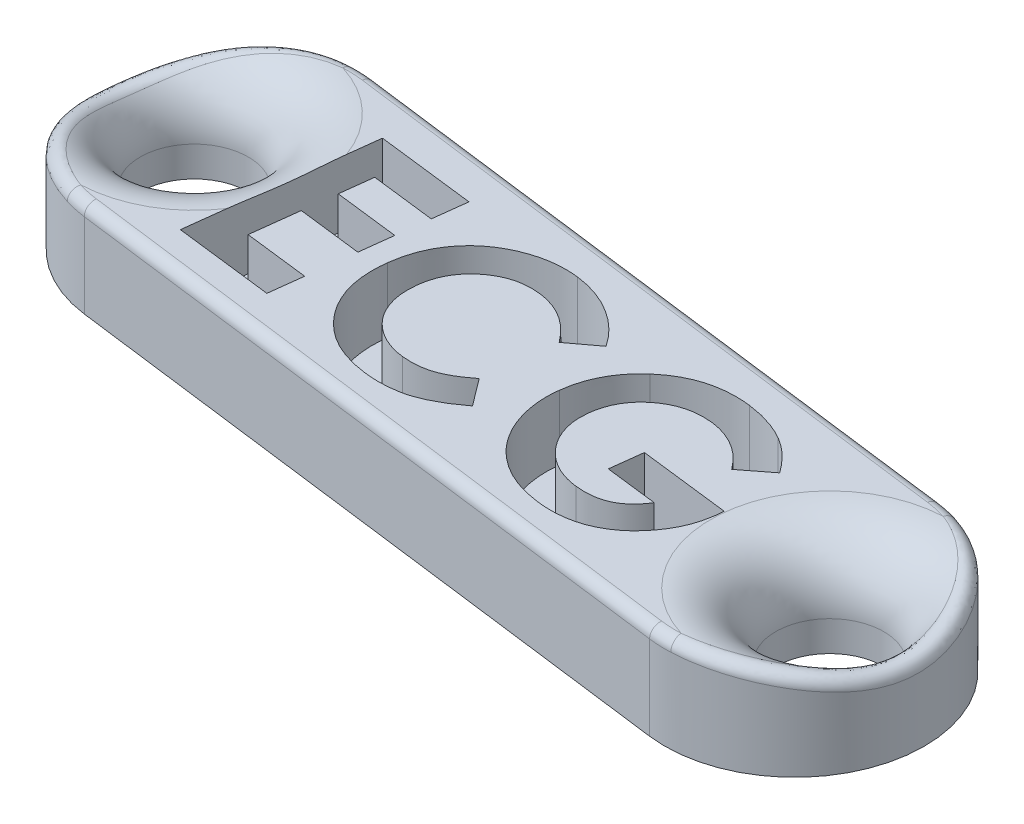
from build123d import *

# Parameters (mm, degrees)
BOSS_EXTRUDE1_DEPTH = 2.2
SKETCH3_R           = 1.25
CUT_EXTRUDE1_DEPTH  = 3
CUT_EXTRUDE2_DEPTH  = 1.5
FILLET1_R           = 1.5
FILLET7_R           = 0.25


with BuildPart() as part:
    # Sketch1 → Boss-Extrude1 (new body)
    with BuildSketch(Plane(origin=(0, 0, 0), x_dir=(1, 0, 0), z_dir=(0, 1, 0))):
        with BuildLine():
            Line((-7.119052023, 3.935857167), (7.880947977, 2.015572456))
            ThreePointArc((7.880947977, 2.015572456), (10.475714811, -1.341090333), (7.119052023, -3.935857167))
            Line((7.119052023, -3.935857167), (-7.880947977, -2.015572456))
            ThreePointArc((-7.880947977, -2.015572456), (-10.475714811, 1.341090333), (-7.119052023, 3.935857167))
        make_face()
    extrude(amount=BOSS_EXTRUDE1_DEPTH)

    # Sketch3 → Cut-Extrude1 (cut)
    with BuildSketch(Plane(origin=(0, 2.2, 0), x_dir=(1, 0, 0), z_dir=(0, 1, 0))):
        with Locations(Location((-8.431191966, 1.079352602, 0), (0, 0, 270))):
            Circle(SKETCH3_R)
        with Locations(Location((8.431191966, -1.079352602, 0), (0, 0, 270))):
            Circle(SKETCH3_R)
    extrude(amount=-CUT_EXTRUDE1_DEPTH, mode=Mode.SUBTRACT)

    # Sketch2 → Cut-Extrude2 (cut)
    with BuildSketch(Plane(origin=(0, 2.2, 0), x_dir=(1, 0, 0), z_dir=(0, 1, 0))):
        Polygon((-5.755753406, 2.758586424), (-3.478810297, 2.482978785), (-3.572940906, 1.705341232), (-5.061222156, 1.885122215), (-5.151960671, 1.131229319), (-3.663679421, 0.951448337), (-3.756113983, 0.189075206), (-5.244395233, 0.368856189), (-5.377534923, -0.728486225), (-3.889253673, -0.908267208), (-3.983384282, -1.688448832), (-6.260327391, -1.412841193), align=None)
        with BuildLine():
            Line((1.001287101, 1.174388755), (0.38138192, 0.710519898))
            add(Edge.make_bspline(
                [(0.38138192, 0.710519898), (0.339907613, 0.763880498), (0.258781245, 0.868257209), (0.124147649, 1.008204653), (-0.016431096, 1.1309551), (-0.164250314, 1.234701384), (-0.319093637, 1.320558606), (-0.480652107, 1.387556123), (-0.649012659, 1.437088172), (-0.764593546, 1.454695824), (-0.822811456, 1.46356477)],
                knots=[0, 0, 0, 0, 1.108790908, 2.168865199, 3.182047536, 4.168153944, 5.127710862, 6.08254375, 7.034180319, 8, 8, 8, 8], degree=3))
            add(Edge.make_bspline(
                [(-0.822811456, 1.46356477), (-0.871945413, 1.468588946), (-0.968373777, 1.478449195), (-1.112120386, 1.474795944), (-1.251346797, 1.460261609), (-1.386341531, 1.431110512), (-1.516791346, 1.388515197), (-1.642926234, 1.332157847), (-1.764720825, 1.262147666), (-1.880649901, 1.179543408), (-1.988777712, 1.086962675), (-2.085926714, 0.985578857), (-2.171480701, 0.876835298), (-2.243309433, 0.759621132), (-2.305487808, 0.636139794), (-2.353360208, 0.504252552), (-2.38938141, 0.365004543), (-2.403814451, 0.269145393), (-2.41115948, 0.220362313)],
                knots=[0, 0, 0, 0, 1.052642957, 2.065875484, 3.060764577, 4.035343905, 5.005978876, 5.983166527, 6.977196326, 7.997848495, 9.01557503, 10.009312133, 10.988804212, 11.961030067, 12.93726835, 13.933143802, 14.948169155, 16, 16, 16, 16], degree=3))
            add(Edge.make_bspline(
                [(-2.41115948, 0.220362313), (-2.414682864, 0.186189579), (-2.421659114, 0.118528067), (-2.424792083, 0.017408498), (-2.422440409, -0.081421976), (-2.41390286, -0.178009521), (-2.399472091, -0.272333387), (-2.379210871, -0.364719086), (-2.352870931, -0.454822226), (-2.3206034, -0.542397648), (-2.282526175, -0.626771823), (-2.239477231, -0.707912071), (-2.189615486, -0.783980139), (-2.136361713, -0.857695581), (-2.07664337, -0.927005757), (-2.01235478, -0.993303363), (-1.942602983, -1.055345941), (-1.86783715, -1.112771481), (-1.789471122, -1.16635695), (-1.706873808, -1.213458243), (-1.622223262, -1.25633634), (-1.534014027, -1.292414503), (-1.443641071, -1.325488341), (-1.349171211, -1.350106329), (-1.25217272, -1.371030188), (-1.186120182, -1.380270091), (-1.152692599, -1.384946181)],
                knots=[0, 0, 0, 0, 1.081513024, 2.14137991, 3.183188021, 4.192979156, 5.192557174, 6.186052631, 7.169125398, 8.146377767, 9.122494361, 10.082280144, 11.035355505, 11.984306692, 12.944009917, 13.91340653, 14.890658899, 15.880598942, 16.880493984, 17.877492441, 18.872701132, 19.866236465, 20.876968766, 21.900476918, 22.937482463, 24, 24, 24, 24], degree=3))
            add(Edge.make_bspline(
                [(-1.152692599, -1.384946181), (-1.095931408, -1.390004726), (-0.984500042, -1.399935465), (-0.818638147, -1.395791692), (-0.658744047, -1.373249868), (-0.528533482, -1.341771259), (-0.426162575, -1.305578155), (-0.34684601, -1.271942103), (-0.264544067, -1.23310381), (-0.179820352, -1.18737488), (-0.093335181, -1.133977735), (-0.003330233, -1.076093294), (0.088208177, -1.010077162), (0.149681701, -0.963599919), (0.181248373, -0.939733841)],
                knots=[0, 0, 0, 0, 1.415064442, 2.777999525, 4.110910369, 5.420790316, 6.098256209, 6.806511331, 7.560473776, 8.358639852, 9.196952851, 10.08523006, 11.016765106, 12, 12, 12, 12], degree=3))
            Line((0.181248373, -0.939733841), (0.651901418, -1.566423211))
            add(Edge.make_bspline(
                [(0.651901418, -1.566423211), (0.609363773, -1.597996987), (0.526214817, -1.659714707), (0.401750427, -1.746961915), (0.278712285, -1.823653103), (0.158663836, -1.893008251), (0.041208592, -1.953774087), (-0.073300151, -2.007119508), (-0.185790595, -2.050060322), (-0.295954469, -2.086601641), (-0.406974323, -2.114285954), (-0.519433231, -2.137695053), (-0.635066381, -2.153475196), (-0.753390342, -2.163473703), (-0.874766364, -2.168686498), (-0.99931683, -2.167994616), (-1.126895442, -2.159972947), (-1.212648227, -2.151015493), (-1.256151467, -2.146471288)],
                knots=[0, 0, 0, 0, 1.237411397, 2.418786136, 3.549109657, 4.622781696, 5.656380138, 6.637260003, 7.57161251, 8.467374033, 9.346556179, 10.242633998, 11.149328105, 12.070523369, 13.015546583, 13.986172483, 14.978365299, 16, 16, 16, 16], degree=3))
            add(Edge.make_bspline(
                [(-1.256151467, -2.146471288), (-1.335306552, -2.135274875), (-1.490478126, -2.113326001), (-1.714092962, -2.05512783), (-1.92522605, -1.981907537), (-2.122663198, -1.889063155), (-2.306855586, -1.778349608), (-2.477805395, -1.649706023), (-2.633923901, -1.501721022), (-2.777070434, -1.339116949), (-2.901957917, -1.162324841), (-3.007807279, -0.975757518), (-3.093334976, -0.780667662), (-3.156851176, -0.576655029), (-3.200619349, -0.364198715), (-3.221767367, -0.143140284), (-3.224216426, 0.086274813), (-3.209182871, 0.240793343), (-3.201517386, 0.319581063)],
                knots=[0, 0, 0, 0, 1.087864914, 2.13259467, 3.140654736, 4.127373104, 5.097821131, 6.062487821, 7.034682597, 8.022189064, 9.008005977, 9.976780585, 10.938678378, 11.902922557, 12.881323775, 13.887161772, 14.922681284, 16, 16, 16, 16], degree=3))
            add(Edge.make_bspline(
                [(-3.201517386, 0.319581063), (-3.194548117, 0.37085516), (-3.18080427, 0.471970975), (-3.148943416, 0.620060752), (-3.109127711, 0.762452377), (-3.061668102, 0.899707973), (-3.005507143, 1.031428035), (-2.941258992, 1.158023293), (-2.867703241, 1.278554219), (-2.787457572, 1.394449999), (-2.69814106, 1.503063168), (-2.603443801, 1.606663837), (-2.499846289, 1.701363597), (-2.390913556, 1.790917032), (-2.273763627, 1.872063089), (-2.150955678, 1.948281837), (-2.02005273, 2.015457916), (-1.883710228, 2.076586698), (-1.743401081, 2.129772243), (-1.600255203, 2.17309229), (-1.456078286, 2.207051334), (-1.310501161, 2.231706494), (-1.163507721, 2.24730179), (-1.015049467, 2.251922447), (-0.865175638, 2.248189566), (-0.765381674, 2.237903491), (-0.715112471, 2.232722088)],
                knots=[0, 0, 0, 0, 1.063671236, 2.09762803, 3.111591302, 4.102366731, 5.081549333, 6.053737683, 7.01865355, 7.982886452, 8.949656145, 9.907984879, 10.866313613, 11.833083306, 12.805410645, 13.794291844, 14.802960407, 15.828057363, 16.865488062, 17.885960746, 18.901039554, 19.909138579, 20.920098794, 21.937853218, 22.961235026, 24, 24, 24, 24], degree=3))
            add(Edge.make_bspline(
                [(-0.715112471, 2.232722088), (-0.672351433, 2.226984036), (-0.586998642, 2.215530648), (-0.460749194, 2.189811269), (-0.336492094, 2.157489084), (-0.214424519, 2.11856053), (-0.094418725, 2.072584365), (0.023333336, 2.01964535), (0.13996146, 1.961594682), (0.253151031, 1.895268772), (0.362886962, 1.823172867), (0.469490573, 1.747197704), (0.570293439, 1.664705938), (0.666260193, 1.576966056), (0.758337639, 1.484709938), (0.844214937, 1.386110791), (0.926665918, 1.283478432), (0.976306061, 1.210908863), (1.001287101, 1.174388755)],
                knots=[0, 0, 0, 0, 0.99536994, 1.986799332, 2.970884144, 3.956955873, 4.941840252, 5.934642044, 6.935234821, 7.946613122, 8.959777847, 9.964508172, 10.965951071, 11.963306778, 12.964218435, 13.971803263, 14.979324746, 16, 16, 16, 16], degree=3))
        make_face()
        with BuildLine():
            Line((5.547100934, 0.647207502), (4.921259588, 0.161290034))
            add(Edge.make_bspline(
                [(4.921259588, 0.161290034), (4.882333786, 0.211546244), (4.806292695, 0.309721151), (4.678396464, 0.441229444), (4.543497469, 0.556342854), (4.400299043, 0.654549737), (4.249539014, 0.735477498), (4.091266251, 0.799583935), (3.925215962, 0.847076538), (3.810601985, 0.864152582), (3.752683199, 0.872781754)],
                knots=[0, 0, 0, 0, 1.082224105, 2.114111883, 3.118543312, 4.098942051, 5.066304023, 6.027606095, 7.003274623, 8, 8, 8, 8], degree=3))
            add(Edge.make_bspline(
                [(3.752683199, 0.872781754), (3.702136576, 0.877697385), (3.602883112, 0.887349728), (3.455452914, 0.885236661), (3.312885601, 0.870151349), (3.174755992, 0.841263461), (3.041396443, 0.798517416), (2.912224267, 0.743506124), (2.788798492, 0.673000656), (2.671120823, 0.590513039), (2.561659424, 0.498140699), (2.463501378, 0.397739738), (2.377899721, 0.290066792), (2.304894075, 0.175093427), (2.243260619, 0.053419528), (2.195078018, -0.075808482), (2.157795058, -0.21170919), (2.144126886, -0.305776873), (2.137198424, -0.353460233)],
                knots=[0, 0, 0, 0, 1.077476719, 2.115735728, 3.123723398, 4.117081565, 5.105879394, 6.09243478, 7.092099243, 8.117637238, 9.139587089, 10.128384918, 11.093722372, 12.054291497, 13.015085546, 13.983663209, 14.977909201, 16, 16, 16, 16], degree=3))
            add(Edge.make_bspline(
                [(2.137198424, -0.353460233), (2.132600744, -0.403159578), (2.123573499, -0.500741005), (2.126014978, -0.646324137), (2.14418021, -0.787457152), (2.175559698, -0.924712557), (2.22086658, -1.058042649), (2.280229948, -1.187259074), (2.355078176, -1.31185666), (2.442464929, -1.43111649), (2.540807973, -1.542311576), (2.648072744, -1.642137956), (2.763429386, -1.729416966), (2.886764962, -1.80378367), (3.017503018, -1.867677371), (3.156764949, -1.917007928), (3.303777703, -1.955104899), (3.405095881, -1.969890948), (3.456722996, -1.977425244)],
                knots=[0, 0, 0, 0, 1.026608968, 2.01567986, 2.989024484, 3.950000734, 4.908420604, 5.881886902, 6.87054715, 7.894433122, 8.920514559, 9.920744447, 10.905013829, 11.891686886, 12.880347134, 13.894219595, 14.92699049, 16, 16, 16, 16], degree=3))
            add(Edge.make_bspline(
                [(3.456722996, -1.977425244), (3.490334146, -1.980845689), (3.556600311, -1.987589279), (3.654561589, -1.992174811), (3.74920476, -1.989563491), (3.840051897, -1.980833178), (3.928107896, -1.967847784), (4.012363752, -1.947065602), (4.093803873, -1.922056946), (4.171265239, -1.889278243), (4.246027315, -1.850947378), (4.318811672, -1.807202174), (4.38722735, -1.754424907), (4.454369049, -1.69729593), (4.518229546, -1.633023289), (4.579422349, -1.562691785), (4.637175647, -1.484883406), (4.673078378, -1.429797635), (4.691445219, -1.401617284)],
                knots=[0, 0, 0, 0, 1.116837852, 2.201905125, 3.239617865, 4.243927897, 5.218043446, 6.179116346, 7.110140328, 8.031735976, 8.955414115, 9.886625691, 10.834246109, 11.808361658, 12.799585801, 13.826426824, 14.888060325, 16, 16, 16, 16], degree=3))
            Line((4.691445219, -1.401617284), (3.483859749, -1.255757242))
            Line((3.483859749, -1.255757242), (3.574598263, -0.510344581))
            Line((3.574598263, -0.510344581), (5.672608413, -0.763903609))
            Line((5.672608413, -0.763903609), (5.65734399, -0.940292498))
            add(Edge.make_bspline(
                [(5.65734399, -0.940292498), (5.650823224, -0.985613884), (5.637873468, -1.075618791), (5.608836701, -1.208602113), (5.570893913, -1.338519008), (5.522626822, -1.464963696), (5.467868215, -1.589493448), (5.402902645, -1.710694176), (5.330123901, -1.829538721), (5.248847001, -1.944339096), (5.161501831, -2.05353676), (5.069229542, -2.156058385), (4.973315566, -2.251151815), (4.871280224, -2.336773182), (4.766488012, -2.416443328), (4.655869932, -2.486264133), (4.541758032, -2.549735609), (4.423254155, -2.604626778), (4.300609411, -2.651500753), (4.174032653, -2.689928596), (4.043229158, -2.718477715), (3.908633164, -2.738610263), (3.770493891, -2.751715952), (3.628260987, -2.754899252), (3.482171468, -2.748745056), (3.383753375, -2.738875621), (3.333759588, -2.73386221)],
                knots=[0, 0, 0, 0, 1.006578571, 1.998990296, 2.990272399, 3.979662424, 4.973027484, 5.979606055, 7.000873861, 8.035596299, 9.070393411, 10.073877441, 11.067223055, 12.037389839, 13.000823087, 13.959512707, 14.910981637, 15.870396377, 16.828521635, 17.795976668, 18.776245708, 19.769591321, 20.787031089, 21.825350433, 22.895335564, 24, 24, 24, 24], degree=3))
            add(Edge.make_bspline(
                [(3.333759588, -2.73386221), (3.280509626, -2.726595801), (3.175172049, -2.712221596), (3.020594754, -2.679566872), (2.871640985, -2.639105528), (2.728047073, -2.590403653), (2.589909119, -2.533892931), (2.457109603, -2.468259459), (2.330004483, -2.394455992), (2.208543793, -2.313152449), (2.093798787, -2.223861896), (1.986364136, -2.127541476), (1.886640177, -2.02412368), (1.793923348, -1.914759162), (1.709218139, -1.798355489), (1.631565559, -1.675433418), (1.561274194, -1.546113103), (1.499674999, -1.410489475), (1.446498834, -1.271128379), (1.402000894, -1.12937112), (1.36825351, -0.985599051), (1.343601166, -0.840582059), (1.328348445, -0.694418543), (1.322236726, -0.546852051), (1.326337493, -0.397796908), (1.336598124, -0.298290603), (1.341752377, -0.248305319)],
                knots=[0, 0, 0, 0, 1.086404573, 2.14909496, 3.191799546, 4.205801276, 5.213095556, 6.207447127, 7.198573695, 8.183019474, 9.160555024, 10.135999586, 11.098039105, 12.063333118, 13.032797836, 14.006432169, 15.001325697, 16.006525893, 17.016023186, 18.01574843, 19.008390079, 19.999730874, 20.98820046, 21.977826132, 22.984195656, 24, 24, 24, 24], degree=3))
            add(Edge.make_bspline(
                [(1.341752377, -0.248305319), (1.351574573, -0.180523893), (1.37097843, -0.046620941), (1.420659345, 0.148227957), (1.487120745, 0.334066426), (1.569654729, 0.510817073), (1.667585014, 0.679280577), (1.782931555, 0.838305532), (1.914180622, 0.989032063), (2.012798013, 1.080283963), (2.062572355, 1.126340782)],
                knots=[0, 0, 0, 0, 1.034205602, 2.043084539, 3.031904675, 4.012063662, 4.98625913, 5.971253671, 6.976047603, 8, 8, 8, 8], degree=3))
            add(Edge.make_bspline(
                [(2.062572355, 1.126340782), (2.093390686, 1.152685053), (2.154597228, 1.20500592), (2.250711524, 1.277040279), (2.349099877, 1.342965052), (2.449270475, 1.404096156), (2.553118321, 1.456625316), (2.658050281, 1.505917672), (2.766190646, 1.546676433), (2.87582711, 1.584059526), (2.988400359, 1.613429987), (3.103491838, 1.636049278), (3.220577114, 1.654054413), (3.340016364, 1.666163605), (3.462046909, 1.670600018), (3.586271602, 1.671154027), (3.713073664, 1.664166558), (3.797946169, 1.655037237), (3.840877644, 1.650419308)],
                knots=[0, 0, 0, 0, 1.016696083, 2.019202582, 3.010261863, 3.986630401, 4.960111641, 5.927688546, 6.89279465, 7.856858523, 8.831913369, 9.807998711, 10.797662222, 11.802247391, 12.816988693, 13.859197377, 14.917107329, 16, 16, 16, 16], degree=3))
            add(Edge.make_bspline(
                [(3.840877644, 1.650419308), (3.88589771, 1.644380845), (3.975159264, 1.632408351), (4.106943569, 1.606412941), (4.235975496, 1.575656618), (4.361497015, 1.536635821), (4.484870044, 1.494247548), (4.604255711, 1.443231744), (4.721938372, 1.389080736), (4.797149276, 1.346780205), (4.834761191, 1.325626305)],
                knots=[0, 0, 0, 0, 1.03535624, 2.052806966, 3.060990054, 4.057904933, 5.048488006, 6.03352108, 7.016591576, 8, 8, 8, 8], degree=3))
            add(Edge.make_bspline(
                [(4.834761191, 1.325626305), (4.866434029, 1.306571864), (4.930588006, 1.267976707), (5.022655783, 1.200825137), (5.114963046, 1.128293718), (5.20418042, 1.046397463), (5.293178419, 0.958198833), (5.378924743, 0.860964963), (5.465239873, 0.75785063), (5.519487746, 0.684529392), (5.547100934, 0.647207502)],
                knots=[0, 0, 0, 0, 0.894861287, 1.812559683, 2.757812128, 3.736973459, 4.743985581, 5.791341498, 6.875751249, 8, 8, 8, 8], degree=3))
        make_face()
    extrude(amount=-CUT_EXTRUDE2_DEPTH, mode=Mode.SUBTRACT)

    # Fillet1
    # the kernel refuses this fillet: 1.5 mm, written as the material it takes off along each edge
    with BuildSketch(Plane(origin=(-8.431191966, 2.2, -1.079352602), x_dir=(0, 0, 1), z_dir=(-1, 0, 0))) as fillet1_piece_1:
        with BuildLine():
            CenterArc((1.25 + FILLET1_R, -FILLET1_R), FILLET1_R, 90, 90)
            Line((1.25, -FILLET1_R), (1.25, 0))
            Line((1.25, 0), (1.25 + FILLET1_R, 0))
        make_face()
    revolve(axis=Axis((-8.431191966, 2.2, -1.079352602), (0, 1, 0)), mode=Mode.SUBTRACT)
    with BuildSketch(Plane(origin=(8.431191966, 2.2, 1.079352602), x_dir=(0, 0, 1), z_dir=(-1, 0, 0))) as fillet1_piece_2:
        with BuildLine():
            CenterArc((1.25 + FILLET1_R, -FILLET1_R), FILLET1_R, 90, 90)
            Line((1.25, -FILLET1_R), (1.25, 0))
            Line((1.25, 0), (1.25 + FILLET1_R, 0))
        make_face()
    revolve(axis=Axis((8.431191966, 2.2, 1.079352602), (0, 1, 0)), mode=Mode.SUBTRACT)

    # Fillet7
    fillet7_edges = [part.edges().sort_by_distance(p)[0] for p in [
        (-8.498959011, 2.2, 1.868652599),
        (7.754143202, 2.2, 3.949358178),
        (8.498959011, 2.2, -1.868652599),
        (10.479138155, 2.032534441, 1.313321953),
        (-10.475714811, 2.032503738, -1.341090333),
        (0.380947977, 2.2, -2.975714811),
        (-7.754143202, 2.2, -3.949358178),
        (-0.380947977, 2.2, 2.975714811),
    ]]
    fillet(fillet7_edges, radius=FILLET7_R)


solid = part.part
